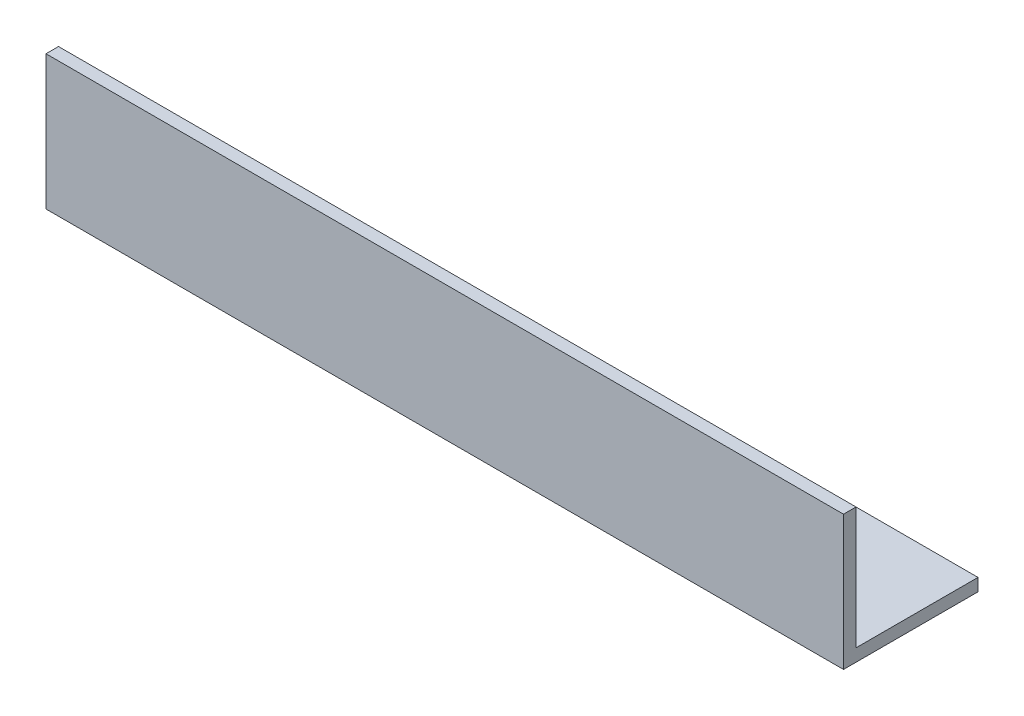
from build123d import *

# Parameters (mm, degrees)
EXTRUDE_1_DEPTH     = 255
SKETCH_2_R          = 5
CUT_EXTRUDE_1_DEPTH = 263.150720007


with BuildPart() as part:
    # Эскиз1 → Вытянуть-Тонкостенный1 (new body)
    with BuildSketch(Plane(origin=(0, 0, 0), x_dir=(0, 0, -1), z_dir=(1, 0, 0))):
        Polygon((0, 43), (0, 0), (43, 0), (43, 4), (4, 4), (4, 43), align=None)
    extrude(amount=EXTRUDE_1_DEPTH)

    # Эскиз2 → Вырез-Вытянуть1 (cut, through all)
    with BuildSketch(Plane.XZ):
        with Locations((80, -23)):
            Circle(SKETCH_2_R)
        with Locations((180, -23)):
            Circle(SKETCH_2_R)
    extrude(amount=-CUT_EXTRUDE_1_DEPTH, mode=Mode.SUBTRACT)


solid = part.part
